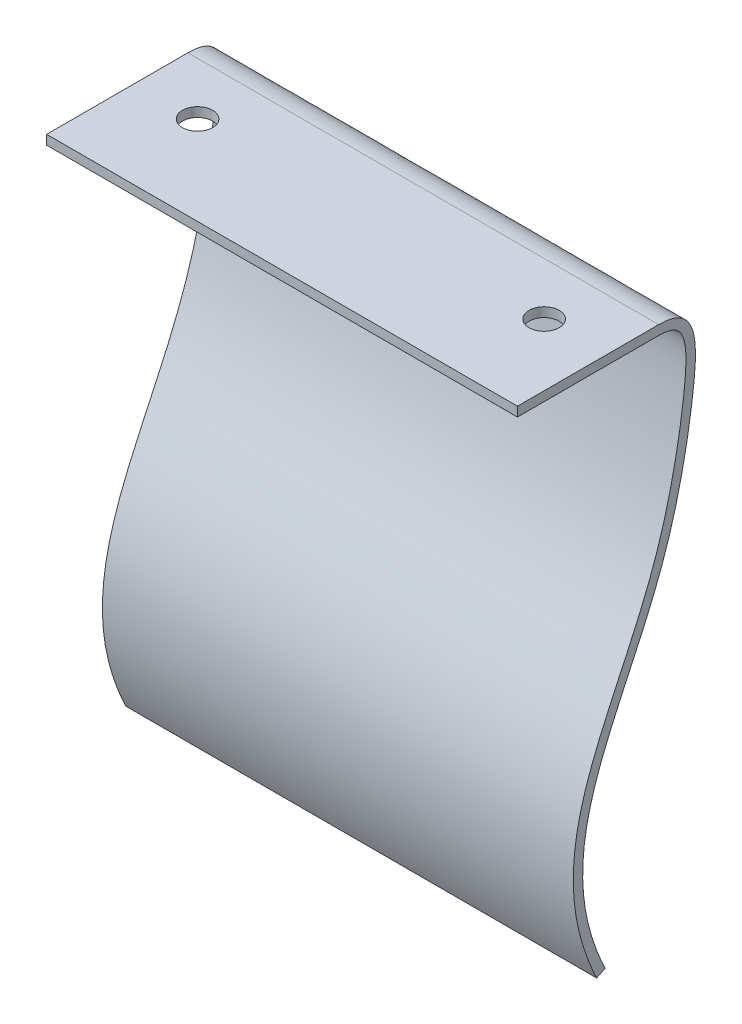
from build123d import *

# Parameters (mm, degrees)
EXTRUDE_THIN2_DEPTH = 50
CUT_EXTRUDE1_REACH  = 79.991
SKETCH3_R           = 1.6


# Read off the part's stored shape, not the designer's step: Extrude-Thin2
with BuildPart() as part:
    # Extrude-Thin2 outline → Extrude-Thin2 (new body)
    with BuildSketch(Plane(origin=(0, 0, 0), x_dir=(0, 0, -1), z_dir=(1, 0, 0))):
        with BuildLine():
            Line((0, -1), (15, -1))
            add(Edge.make_bspline(
                [(15, -1), (15.47470013, -1), (15.861826032, -1.051589998), (16.480855292, -1.220985667), (16.712550056, -1.336053941), (17.089368537, -1.613453741), (17.238727793, -1.77767428), (17.501655418, -2.204581945), (17.612769335, -2.469390698), (17.783374091, -3.115625013), (17.841976302, -3.495679067), (17.902505292, -4.354355009), (17.904704994, -4.832563181), (17.861462775, -5.869536859), (17.816186167, -6.428296676), (17.691586748, -7.612293875), (17.612995195, -8.238955838), (17.163932748, -11.483031174), (16.606541025, -14.44214967), (15.654491825, -18.050324208), (15.451355727, -18.767419737), (15.019686347, -20.178768294), (14.790947871, -20.871355568), (14.06749291, -22.914211322), (13.537719224, -24.230859394), (11.877778677, -28.084635108), (10.676244262, -30.525126108), (8.480745218, -35.362065845), (7.485826344, -37.759496578), (6.134782684, -42.729757515), (5.781916626, -45.305843109), (6.176613166, -50.78276898), (6.924566965, -53.675807088), (8.40515267, -56.793673131)],
                knots=[0, 0, 0, 0, 0.03125, 0.03125, 0.0625, 0.0625, 0.09375, 0.09375, 0.125, 0.125, 0.15625, 0.15625, 0.1875, 0.1875, 0.21875, 0.21875, 0.25, 0.25, 0.375, 0.375, 0.40625, 0.40625, 0.4375, 0.4375, 0.5, 0.5, 0.625, 0.625, 0.75, 0.75, 0.875, 0.875, 1, 1, 1, 1], degree=3))
            Line((8.40515267, -56.793673131), (9.308475158, -56.364711032))
            add(Edge.make_bspline(
                [(15, 0), (19.130938443, 0), (19.312220409, -5.977847724), (14.406460667, -31.179131787), (2.663773864, -42.372080643), (9.308475158, -56.364711032)],
                knots=[0, 0, 0, 0, 0.236283029, 0.420799842, 1, 1, 1, 1], degree=3))
            Line((15, 0), (0, 0))
            Line((0, 0), (0, -1))
        make_face()
    extrude(amount=EXTRUDE_THIN2_DEPTH)

    # Sketch3 → Cut-Extrude1 (cut, up to next)
    with BuildSketch(Plane(origin=(0, 0, 0), x_dir=(1, 0, 0), z_dir=(0, 1, 0)), mode=Mode.PRIVATE) as cut_extrude1_sk1:
        with Locations(Location((6.6, 9.428361527, 0), (0, 0, 270))):
            Circle(SKETCH3_R)
    cut_extrude1_tool1 = extrude(cut_extrude1_sk1.sketch, amount=-CUT_EXTRUDE1_REACH, mode=Mode.PRIVATE) & part.part
    # Sketch3 → Cut-Extrude1 (cut, up to next)
    with BuildSketch(Plane(origin=(0, 0, 0), x_dir=(1, 0, 0), z_dir=(0, 1, 0)), mode=Mode.PRIVATE) as cut_extrude1_sk2:
        with Locations(Location((43.4, 9.428361527, 0), (0, 0, 270))):
            Circle(SKETCH3_R)
    cut_extrude1_tool2 = extrude(cut_extrude1_sk2.sketch, amount=-CUT_EXTRUDE1_REACH, mode=Mode.PRIVATE) & part.part
    add(cut_extrude1_tool1.solids().sort_by_distance((6.6, 0, -9.428362))[0], mode=Mode.SUBTRACT)
    add(cut_extrude1_tool2.solids().sort_by_distance((43.4, 0, -9.428362))[0], mode=Mode.SUBTRACT)


solid = part.part
